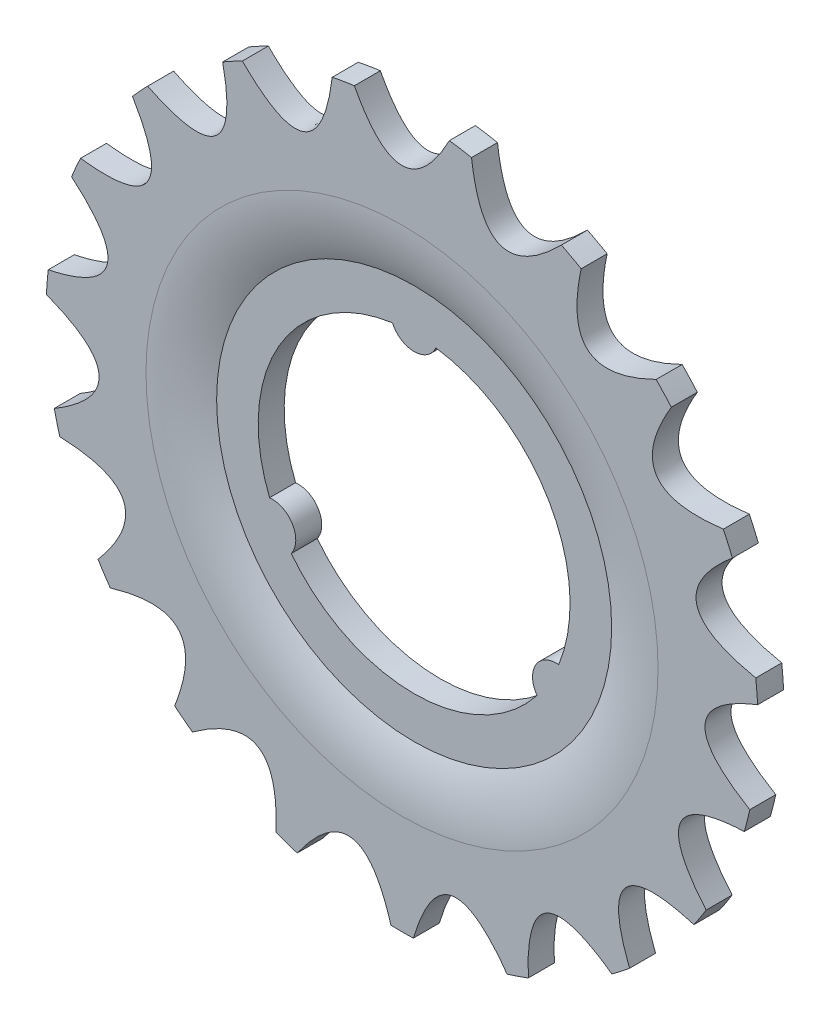
from build123d import *

# Parameters (mm, degrees)
SKETCH_1_R      = 26
EXTRUDE_1_DEPTH = 3
SKETCH_2_R      = 22.8
EXTRUDE_2_DEPTH = 3
FILLET_8_R      = 17


with BuildPart() as part:
    # Эскиз1 → Вытянуть1 (new body)
    with BuildSketch(Plane.XY):
        with BuildLine():
            ThreePointArc((-5.5, 40.730332677), (-6.779718382, 40.536963609), (-8.052713795, 40.303396886))
            add(Edge.make_bspline(
                [(-18.42711223, 36.737603826), (-9.565846889, 27.871779004), (-8.052713795, 40.303396886)],
                knots=[0, 0, 0, 1, 1, 1], degree=2))
            ThreePointArc((-18.42711223, 36.737603826), (-19.574705107, 36.139188148), (-20.702887125, 35.504935779))
            add(Edge.make_bspline(
                [(-29.357360924, 28.763785557), (-18.097494767, 23.255583732), (-20.702887125, 35.504935779)],
                knots=[0, 0, 0, 1, 1, 1], degree=2))
            ThreePointArc((-29.357360924, 28.763785557), (-30.2484688, 27.825170893), (-31.109581398, 26.858963965))
            add(Edge.make_bspline(
                [(-37.106284036, 17.672964807), (-24.667998276, 16.119285114), (-31.109581398, 26.858963965)],
                knots=[0, 0, 0, 1, 1, 1], degree=2))
            ThreePointArc((-37.106284036, 17.672964807), (-37.644341546, 16.49586462), (-38.145069811, 15.302406645))
            add(Edge.make_bspline(
                [(-40.834165508, 4.667004096), (-28.565341408, 7.236211838), (-38.145069811, 15.302406645)],
                knots=[0, 0, 0, 1, 1, 1], degree=2))
            ThreePointArc((-40.834165508, 4.667004096), (-40.960865773, 3.378975456), (-41.046948028, 2.087596124))
            add(Edge.make_bspline(
                [(-40.137031541, -8.844698925), (-29.367186562, -2.431017271), (-41.046948028, 2.087596124)],
                knots=[0, 0, 0, 1, 1, 1], degree=2))
            ThreePointArc((-40.137031541, -8.844698925), (-39.83864462, -10.104078129), (-39.500752518, -11.353437829))
            add(Edge.make_bspline(
                [(-35.090427416, -21.397941578), (-26.986641373, -11.834807939), (-39.500752518, -11.353437829)],
                knots=[0, 0, 0, 1, 1, 1], degree=2))
            ThreePointArc((-35.090427416, -21.397941578), (-34.399288162, -22.492198068), (-33.674037554, -23.564150627))
            add(Edge.make_bspline(
                [(-26.241230996, -31.632385237), (-21.68167485, -19.95611353), (-33.674037554, -23.564150627)],
                knots=[0, 0, 0, 1, 1, 1], degree=2))
            ThreePointArc((-26.241230996, -31.632385237), (-25.232235072, -32.442939344), (-24.198218116, -33.221322069))
            add(Edge.make_bspline(
                [(-14.548390024, -38.438969129), (-14.027162432, -25.91486457), (-24.198218116, -33.221322069)],
                knots=[0, 0, 0, 1, 1, 1], degree=2))
            ThreePointArc((-14.548390024, -38.438969129), (-13.330877794, -38.877984737), (-12.10014627, -39.278447783))
            add(Edge.make_bspline(
                [(-1.27900525, -41.080094274), (-4.85258931, -29.065337922), (-12.10014627, -39.278447783)],
                knots=[0, 0, 0, 1, 1, 1], degree=2))
            ThreePointArc((-1.27900525, -41.080094274), (0.015086944, -41.099997231), (1.309164177, -41.079144212))
            add(Edge.make_bspline(
                [(12.128979588, -39.269553781), (4.84783716, -29.066130916), (1.309164177, -41.079144212)],
                knots=[0, 0, 0, 1, 1, 1], degree=2))
            ThreePointArc((12.128979588, -39.269553781), (13.359416777, -38.868187292), (14.576606372, -38.428277956))
            add(Edge.make_bspline(
                [(24.222601287, -33.203547806), (14.022925251, -25.917157617), (14.576606372, -38.428277956)],
                knots=[0, 0, 0, 1, 1, 1], degree=2))
            ThreePointArc((24.222601287, -33.203547806), (25.256046509, -32.424406158), (26.264447087, -31.613111508))
            add(Edge.make_bspline(
                [(33.691328284, -23.53942222), (21.678411803, -19.959658145), (26.264447087, -31.613111508)],
                knots=[0, 0, 0, 1, 1, 1], degree=2))
            ThreePointArc((33.691328284, -23.53942222), (34.415791714, -22.466937501), (35.106127425, -21.3721739))
            add(Edge.make_bspline(
                [(39.509077087, -11.324434984), (26.984706061, -11.839220006), (35.106127425, -21.3721739)],
                knots=[0, 0, 0, 1, 1, 1], degree=2))
            ThreePointArc((39.509077087, -11.324434984), (39.846051872, -10.074827555), (40.143514129, -8.815229627))
            add(Edge.make_bspline(
                [(41.045404341, 2.117730498), (29.366788706, -2.435818675), (40.143514129, -8.815229627)],
                knots=[0, 0, 0, 1, 1, 1], degree=2))
            ThreePointArc((41.045404341, 2.117730498), (40.958374033, 3.409046284), (40.830728186, 4.696981559))
            add(Edge.make_bspline(
                [(38.13382515, 15.330407021), (28.566524123, 7.231541404), (40.830728186, 4.696981559)],
                knots=[0, 0, 0, 1, 1, 1], degree=2))
            ThreePointArc((38.13382515, 15.330407021), (37.632220833, 16.523497062), (37.093299291, 17.700201912))
            add(Edge.make_bspline(
                [(31.089854296, 26.881796068), (24.670633395, 16.115251764), (37.093299291, 17.700201912)],
                knots=[0, 0, 0, 1, 1, 1], degree=2))
            ThreePointArc((31.089854296, 26.881796068), (30.228032583, 27.847370544), (29.336235855, 28.785330741))
            add(Edge.make_bspline(
                [(20.676815321, 35.520125397), (18.101296735, 23.252624541), (29.336235855, 28.785330741)],
                knots=[0, 0, 0, 1, 1, 1], degree=2))
            ThreePointArc((20.676815321, 35.520125397), (19.548167965, 36.153549331), (18.400136066, 36.751122333))
            add(Edge.make_bspline(
                [(8.023122571, 40.309297987), (9.570403703, 27.870214648), (18.400136066, 36.751122333)],
                knots=[0, 0, 0, 1, 1, 1], degree=2))
            ThreePointArc((8.023122571, 40.309297987), (6.749956027, 40.541930068), (5.470096027, 40.734359569))
            add(Edge.make_bspline(
                [(-5.5, 40.730332677), (0.001292393, 30.277504211), (5.470096027, 40.734359569)],
                knots=[0, 0, 0, 1, 1, 1], degree=2))
        make_face()
        Circle(SKETCH_1_R, mode=Mode.SUBTRACT)
    extrude(amount=EXTRUDE_1_DEPTH)



with BuildPart() as body_2:
    # Эскиз2 → Вытянуть2 (new body)
    with BuildSketch(Plane(origin=(0, 0, 1.6), x_dir=(-1, 0, 0), z_dir=(0, 0, -1))):
        Circle(SKETCH_2_R)
        with BuildLine():
            ThreePointArc((16.687373481, -6.747708226), (15.588457268, 9), (2.5, 17.82554347))
            ThreePointArc((2.5, 17.82554347), (0, 16.199996074), (-2.5, 17.82554347))
            ThreePointArc((-2.5, 17.82554347), (-15.588457268, 9), (-16.687373481, -6.747708226))
            ThreePointArc((-16.687373481, -6.747708226), (-14.029608141, -8.099998037), (-14.187373481, -11.077835244))
            ThreePointArc((-14.187373481, -11.077835244), (0, -18), (14.187373481, -11.077835244))
            ThreePointArc((14.187373481, -11.077835244), (14.029608141, -8.099998037), (16.687373481, -6.747708226))
        make_face(mode=Mode.SUBTRACT)
    extrude(amount=EXTRUDE_2_DEPTH)


with BuildPart() as part_1:
    add(part.part)

    add(body_2.part)  # Повернуть1 merges body 2
    # Эскиз18 → Повернуть1 (revolve)
    with BuildSketch(Plane(origin=(0, 0, 0), x_dir=(1, 0, 0), z_dir=(0, 1, 0))):
        Polygon((26, -3), (22.8, -1.6), (22.8, 1.4), (26, 0), align=None)
    revolve(axis=Axis((0, 0, 0), (0, 0, -1)))

    # Скругление8
    # the kernel refuses this fillet: 17 mm, written as the material it takes off along each edge
    with BuildSketch(Plane(origin=(0, 0, 3), x_dir=(1, 0, 0), z_dir=(0, -1, 0))) as fillet_8_piece_1_section:
        with BuildLine():
            CenterArc((26 + FILLET_8_R * 0.209178456653, -FILLET_8_R), FILLET_8_R, 90, 23.629377731)
            Line((26 - FILLET_8_R * 0.191640377366, -FILLET_8_R * 0.0838426650978), (26, 0))
            Line((26, 0), (26 + FILLET_8_R * 0.209178456653, 0))
        make_face()
    fillet_8_piece_1 = revolve(axis=Axis((0, 0, 3), (0, 0, 1)), mode=Mode.PRIVATE)
    fillet_8_piece_1 = split(fillet_8_piece_1, bisect_by=Plane(origin=(-26.08987022, 0, 1.6), z_dir=(0, 0, 1)), keep=Keep.TOP, mode=Mode.PRIVATE)
    add(fillet_8_piece_1, mode=Mode.SUBTRACT)


solid = part_1.part
